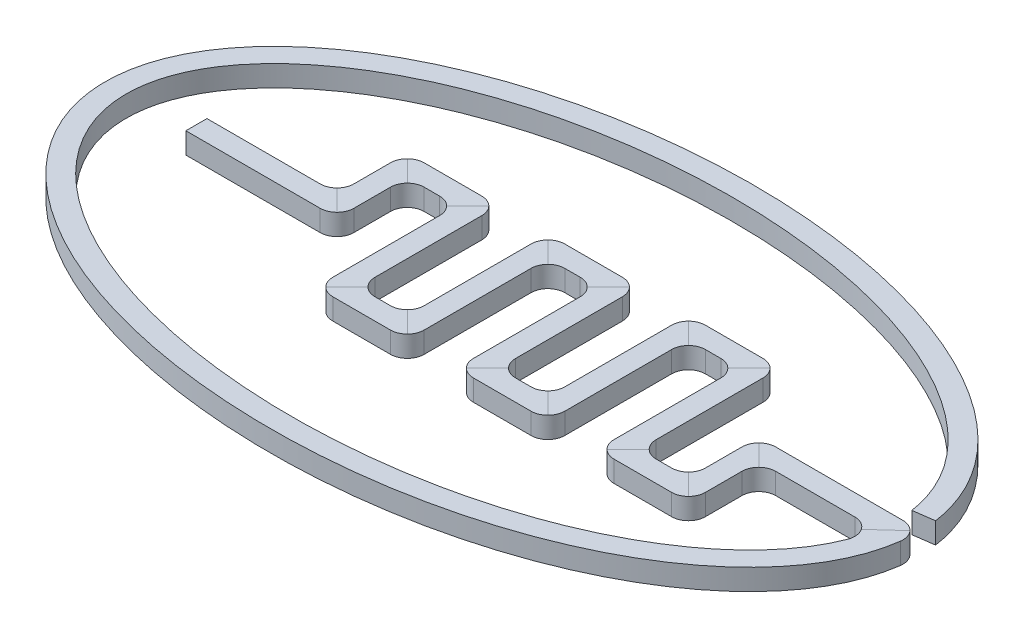
from build123d import *

# Parameters (mm, degrees)
SWEEP_START   = -7.5
SWEEP_1_DEPTH = 15
FILLET_1_R    = 12


# Read off the part's stored shape, not the designer's step: По траектории1
with BuildPart() as part:
    # По траектории1 outline → По траектории1 (new body)
    with BuildSketch(Plane(origin=(0, 0, 0), x_dir=(1, 0, 0), z_dir=(0, 1, 0)).offset(SWEEP_START)):
        with BuildLine():
            add(Edge.make_bspline(
                [(491.534291506, -7.5), (490.431711161, -13.833193331), (488.555554537, -20.171606964), (482.115684964, -35.448920926), (476.744726729, -44.353104615), (462.902791632, -61.662001896), (454.432502579, -70.062576716), (434.666164537, -85.966110311), (423.371960243, -93.467833501), (398.383605791, -107.232562594), (384.690697803, -113.49538022), (355.432367198, -124.512867108), (339.867837194, -129.267496023), (291.262807466, -140.973914026), (256.301926808, -145.330571241), (186.508221322, -146.46302028), (151.700717455, -143.238106083), (103.543263947, -133.110539004), (88.163930088, -128.862523034), (59.342577661, -118.80288823), (45.901519235, -112.991258808), (21.474769197, -100.061904284), (10.490510677, -92.944432095), (-8.61361544, -77.735719207), (-16.731477129, -69.646262932), (-29.855304977, -52.87665194), (-34.861681198, -44.201390502), (-41.717905906, -26.596468678), (-43.575106605, -17.667335788), (-44.181268535, 0.280827976), (-42.930618025, 9.309475628), (-37.278435675, 27.316413994), (-32.869501915, 36.294780847), (-20.908693047, 53.874129057), (-13.356031516, 62.470235741), (4.677091262, 78.881080566), (15.155666309, 86.69388072), (38.65414925, 101.176580865), (51.672635996, 107.846129549), (79.750454456, 119.750989997), (94.80882428, 124.986250541), (142.17593701, 138.212379781), (176.689151807, 143.686157882), (246.406356809, 147.079646242), (281.585032826, 144.998442372), (330.874893049, 136.467598004), (346.726753266, 132.732015601), (376.665946005, 123.634467631), (390.752387218, 118.272485516), (416.617063191, 106.156358908), (428.394052529, 99.402319314), (449.19320626, 84.812558967), (458.213456987, 76.977932612), (473.196226482, 60.600472631), (479.157756478, 52.061688806), (487.918255185, 34.642473972), (490.723171225, 25.762968774), (491.968527455, 16.827137849)],
                knots=[0.009290031, 0.009290031, 0.009290031, 0.009290031, 0.03125, 0.03125, 0.0625, 0.0625, 0.09375, 0.09375, 0.125, 0.125, 0.15625, 0.15625, 0.1875, 0.1875, 0.25, 0.25, 0.3125, 0.3125, 0.34375, 0.34375, 0.375, 0.375, 0.40625, 0.40625, 0.4375, 0.4375, 0.46875, 0.46875, 0.5, 0.5, 0.53125, 0.53125, 0.5625, 0.5625, 0.59375, 0.59375, 0.625, 0.625, 0.65625, 0.65625, 0.6875, 0.6875, 0.75, 0.75, 0.8125, 0.8125, 0.84375, 0.84375, 0.875, 0.875, 0.90625, 0.90625, 0.9375, 0.9375, 0.96875, 0.96875, 1, 1, 1, 1], degree=3))
            Line((491.968527455, 16.827137849), (506.824942904, 18.897625719))
            add(Edge.make_bspline(
                [(508.052207221, 7.5), (507.967725146, 6.311835261), (507.88324307, 5.123670523), (507.745819654, 3.190933227), (507.692878313, 2.44636067), (507.613466301, 1.329501833), (507.586995631, 0.957215555), (507.534054289, 0.212642997), (507.508737718, -0.143428522), (507.458254986, -0.853392582), (507.431682326, -1.201658731), (507.376828377, -1.871278126), (507.347594088, -2.206048217), (507.254473901, -3.210212579), (507.185170526, -3.879460911), (506.955633374, -5.886406206), (506.773770154, -7.223302623), (506.142096179, -11.229085256), (505.606168589, -13.893040485), (503.658696095, -21.852223891), (501.907241159, -27.114193826), (495.345386982, -42.680892081), (489.227134379, -52.761451254), (466.161237835, -81.604617415), (444.474807341, -98.968605394), (391.755380792, -128.008877966), (360.718775264, -139.674517122), (293.638114529, -155.830751546), (257.616304782, -160.311218999), (185.68054913, -161.47842422), (149.793031872, -158.16502834), (83.224481024, -144.165586613), (52.564649897, -133.489821658), (0.777087853, -106.078080489), (-20.360552933, -89.347752028), (-42.478783167, -61.085104791), (-48.257983416, -51.137046524), (-56.276448331, -30.547807695), (-58.508019557, -19.906975825), (-59.231261052, 1.507857695), (-57.722512563, 12.271339565), (-51.109597606, 33.339016559), (-46.013114425, 43.642239156), (-25.846011707, 73.28275302), (-5.880033055, 91.349148662), (43.949511655, 122.060337815), (73.823579369, 134.700404203), (139.303987371, 152.984236358), (174.889897865, 158.616338048), (246.747086075, 162.113990197), (282.99198502, 159.97793863), (351.014083134, 148.205011503), (382.76838365, 138.576766949), (437.327245004, 113.019049836), (460.134474333, 97.100571573), (485.091083423, 69.820844233), (491.874552678, 60.161078706), (502.002880806, 40.022096957), (505.341290653, 29.543307123), (506.824942904, 18.897625719)],
                knots=[-0.008487559, -0.008487559, -0.008487559, -0.008487559, -0.004720861, -0.004720861, -0.00236043, -0.00236043, -0.001180215, -0.001180215, 0, 0, 0.000976562, 0.000976562, 0.001953125, 0.001953125, 0.00390625, 0.00390625, 0.0078125, 0.0078125, 0.015625, 0.015625, 0.03125, 0.03125, 0.0625, 0.0625, 0.125, 0.125, 0.1875, 0.1875, 0.25, 0.25, 0.3125, 0.3125, 0.375, 0.375, 0.4375, 0.4375, 0.46875, 0.46875, 0.5, 0.5, 0.53125, 0.53125, 0.5625, 0.5625, 0.625, 0.625, 0.6875, 0.6875, 0.75, 0.75, 0.8125, 0.8125, 0.875, 0.875, 0.9375, 0.9375, 0.96875, 0.96875, 1, 1, 1, 1], degree=3))
            Line((508.052207221, 7.5), (392.5, 7.5))
            Line((392.5, 7.5), (392.5, -42.5))
            Line((392.5, -42.5), (357.5, -42.5))
            Line((357.5, -42.5), (357.5, 57.5))
            Line((357.5, 57.5), (292.5, 57.5))
            Line((292.5, 57.5), (292.5, -42.5))
            Line((292.5, -42.5), (257.5, -42.5))
            Line((257.5, -42.5), (257.5, 57.5))
            Line((257.5, 57.5), (192.5, 57.5))
            Line((192.5, 57.5), (192.5, -42.5))
            Line((192.5, -42.5), (157.5, -42.5))
            Line((157.5, -42.5), (157.5, 57.5))
            Line((157.5, 57.5), (92.5, 57.5))
            Line((92.5, 57.5), (92.5, 7.5))
            Line((92.5, 7.5), (0, 7.5))
            Line((0, 7.5), (0, -7.5))
            Line((0, -7.5), (107.5, -7.5))
            Line((107.5, -7.5), (107.5, 42.5))
            Line((107.5, 42.5), (142.5, 42.5))
            Line((142.5, 42.5), (142.5, -57.5))
            Line((142.5, -57.5), (207.5, -57.5))
            Line((207.5, -57.5), (207.5, 42.5))
            Line((207.5, 42.5), (242.5, 42.5))
            Line((242.5, 42.5), (242.5, -57.5))
            Line((242.5, -57.5), (307.5, -57.5))
            Line((307.5, -57.5), (307.5, 42.5))
            Line((307.5, 42.5), (342.5, 42.5))
            Line((342.5, 42.5), (342.5, -57.5))
            Line((342.5, -57.5), (407.5, -57.5))
            Line((407.5, -57.5), (407.5, -7.5))
            Line((407.5, -7.5), (491.534291506, -7.5))
        make_face()
    extrude(amount=SWEEP_1_DEPTH)

    # Скругление1
    fillet_1_edges = [part.edges().sort_by_distance(p)[0] for p in [
        (491.534291506, 0, 7.5),
        (508.052207221, 0, -7.5),
        (407.5, 0, 7.5),
        (392.5, 0, -7.5),
        (392.5, 0, 42.5),
        (357.5, 0, 42.5),
        (342.5, 0, -42.5),
        (307.5, 0, -42.5),
        (292.5, 0, 42.5),
        (142.5, 0, -42.5),
        (257.5, 0, 42.5),
        (157.5, 0, 42.5),
        (242.5, 0, -42.5),
        (207.5, 0, -42.5),
        (192.5, 0, 42.5),
        (92.5, 0, -7.5),
        (107.5, 0, 7.5),
        (107.5, 0, -42.5),
        (407.5, 0, 57.5),
        (342.5, 0, 57.5),
        (357.5, 0, -57.5),
        (292.5, 0, -57.5),
        (242.5, 0, 57.5),
        (307.5, 0, 57.5),
        (257.5, 0, -57.5),
        (192.5, 0, -57.5),
        (207.5, 0, 57.5),
        (142.5, 0, 57.5),
        (157.5, 0, -57.5),
        (92.5, 0, -57.5),
    ]]
    fillet(fillet_1_edges, radius=FILLET_1_R)


solid = part.part
